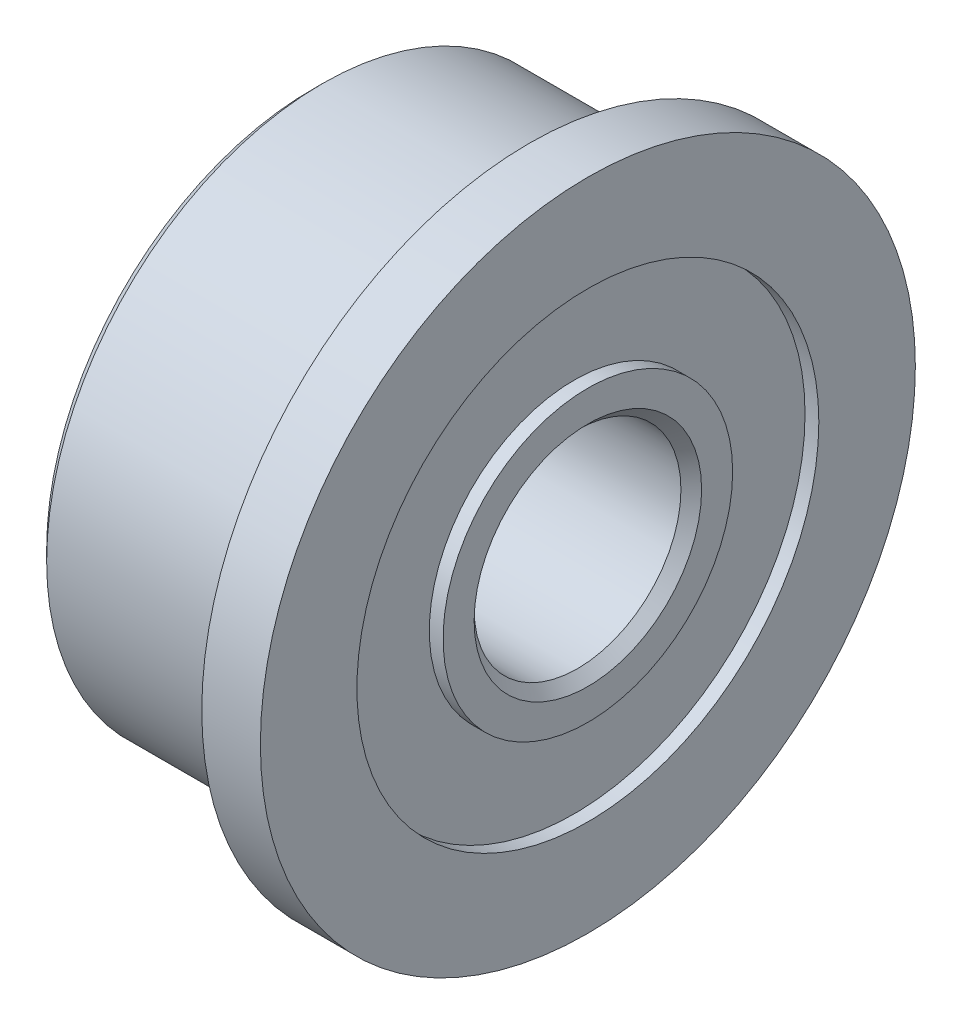
from build123d import *

# Parameters (mm, degrees)
CHAMFER1_SIZE = 0.15


with BuildPart() as part:
    # Sketch1 → Revolve1 (revolve)
    with BuildSketch(Plane.XY):
        with BuildLine():
            Line((-4, 1.5), (0, 1.5))
            Line((0, 1.5), (0, 2.1))
            Line((0, 2.1), (-0.2, 2.1))
            Line((-0.2, 2.1), (-0.2, 3.35))
            Line((-0.2, 3.35), (0, 3.35))
            Line((0, 3.35), (0, 4.75))
            Line((0, 4.75), (-0.85, 4.75))
            Line((-0.85, 4.75), (-0.85, 4.02))
            ThreePointArc((-0.85, 4.02), (-0.835857864, 3.985857864), (-0.87, 4))
            Line((-0.87, 4), (-4, 4))
            Line((-4, 4), (-4, 3.35))
            Line((-4, 3.35), (-3.8, 3.35))
            Line((-3.8, 3.35), (-3.8, 2.1))
            Line((-3.8, 2.1), (-4, 2.1))
            Line((-4, 2.1), (-4, 1.5))
        make_face()
    revolve(axis=Axis((0, 0, 0), (-1, 0, 0)))

    # Chamfer1
    chamfer1_edges = [part.edges().sort_by_distance(p)[0] for p in [
        (0, -1.5, 0),
        (-4, -1.5, 0),
        (-4, -4, 0),
    ]]
    chamfer(chamfer1_edges, length=CHAMFER1_SIZE)


solid = part.part
